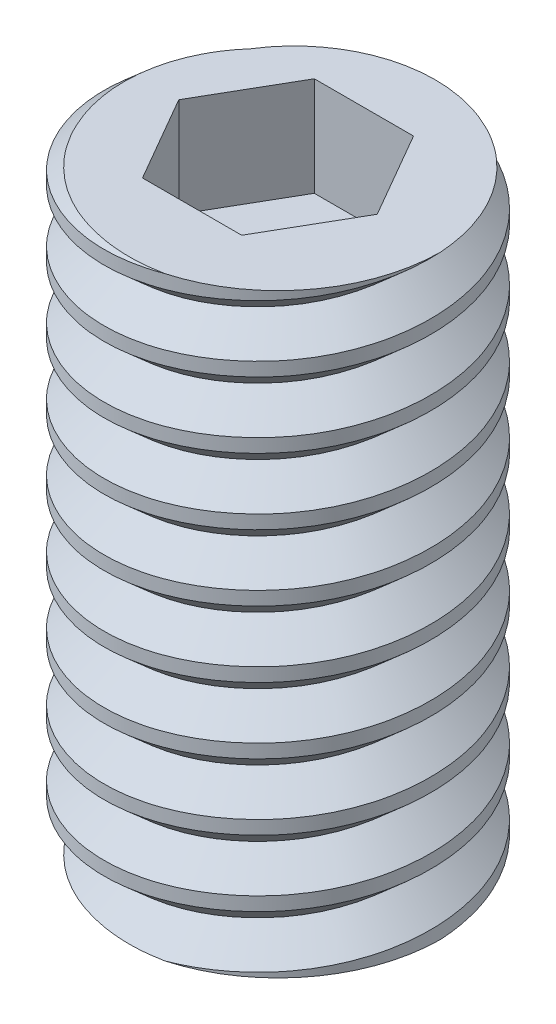
from build123d import *

# Parameters (mm, degrees)
SKETCH1_R           = 1.65
BOSS_EXTRUDE1_DEPTH = 6
CUT_SWEEP2_PITCH    = 0.666666667
CUT_EXTRUDE1_DEPTH  = 1


with BuildPart() as part:
    # Sketch1 → Boss-Extrude1 (new body)
    with BuildSketch(Plane(origin=(0, 0, 0), x_dir=(1, 0, 0), z_dir=(0, 1, 0))):
        with Locations(Location((0, 0, 0), (0, 0, 270))):
            Circle(SKETCH1_R)
    extrude(amount=BOSS_EXTRUDE1_DEPTH)

    # Cut-Sweep2: arcs per turn and ends read off the stored shape
    # Cut-Sweep2: the profile of Sketch2 profile screwed along a right-hand helix through 15 turns, 6 arcs to a turn; built about Z, then put on its axis
    cut_sweep2_z = Axis((0, 0, 0), (0, 0, 1))
    cut_sweep2_corners = [(1.6503, 0, -0.416931242), (1.35, 0, -0.152091536), (1.6503, 0, 0.112748171)]
    with BuildLine(mode=Mode.PRIVATE) as cut_sweep2_profile:
        Line(cut_sweep2_corners[0], cut_sweep2_corners[1])
        Line(cut_sweep2_corners[1], cut_sweep2_corners[2])
        Line(cut_sweep2_corners[2], cut_sweep2_corners[0])
    cut_sweep2_cap = Face(cut_sweep2_profile.wire())
    cut_sweep2_turn_angles = [0, 30, 60, 90, 120, 150, 180, 210, 240, 270, 300, 330, 360]
    cut_sweep2_turn_weights = [1, 0.8660254037844387, 1, 0.8660254037844387, 1, 0.8660254037844387, 1, 0.8660254037844387, 1, 0.8660254037844387, 1, 0.8660254037844387, 1]
    cut_sweep2_turn_rails = [Edge.make_bspline([Vector(p[0], p[1], 0).rotate(cut_sweep2_z, cut_sweep2_turn_angles[k]) / cut_sweep2_turn_weights[k] + Vector(0, 0, p[2] + CUT_SWEEP2_PITCH * cut_sweep2_turn_angles[k] / 360) for k in range(13)], [0, 0, 0, 1, 1, 2, 2, 3, 3, 4, 4, 5, 5, 6, 6, 6], 2, cut_sweep2_turn_weights) for p in cut_sweep2_corners]
    cut_sweep2_turn_sides = [Face.make_surface_from_curves(cut_sweep2_turn_rails[p[0]], cut_sweep2_turn_rails[p[1]]) for p in [(0, 1), (1, 2), (2, 0)]]
    cut_sweep2 = Plane(origin=(0, 6.5, 0), x_dir=(-0.7071067811865537, 0, -0.7071067811865414), z_dir=(0, -1, 0)) * Solid(Shell([*[p.moved(Location((0, 0, CUT_SWEEP2_PITCH * i))) for i in range(15) for p in cut_sweep2_turn_sides], cut_sweep2_cap, cut_sweep2_cap.rotate(cut_sweep2_z, 5400).moved(Location((0, 0, CUT_SWEEP2_PITCH * 5400 / 360)))]))
    add(cut_sweep2, mode=Mode.SUBTRACT)

    # Sketch6 → Cut-Extrude1 (cut)
    with BuildSketch(Plane(origin=(0, 6, 0), x_dir=(1, 0, 0), z_dir=(0, 1, 0))):
        Polygon((1, 0), (0.5, 0.866025404), (-0.5, 0.866025404), (-1, 0), (-0.5, -0.866025404), (0.5, -0.866025404), align=None)
    extrude(amount=-CUT_EXTRUDE1_DEPTH, mode=Mode.SUBTRACT)


solid = part.part
